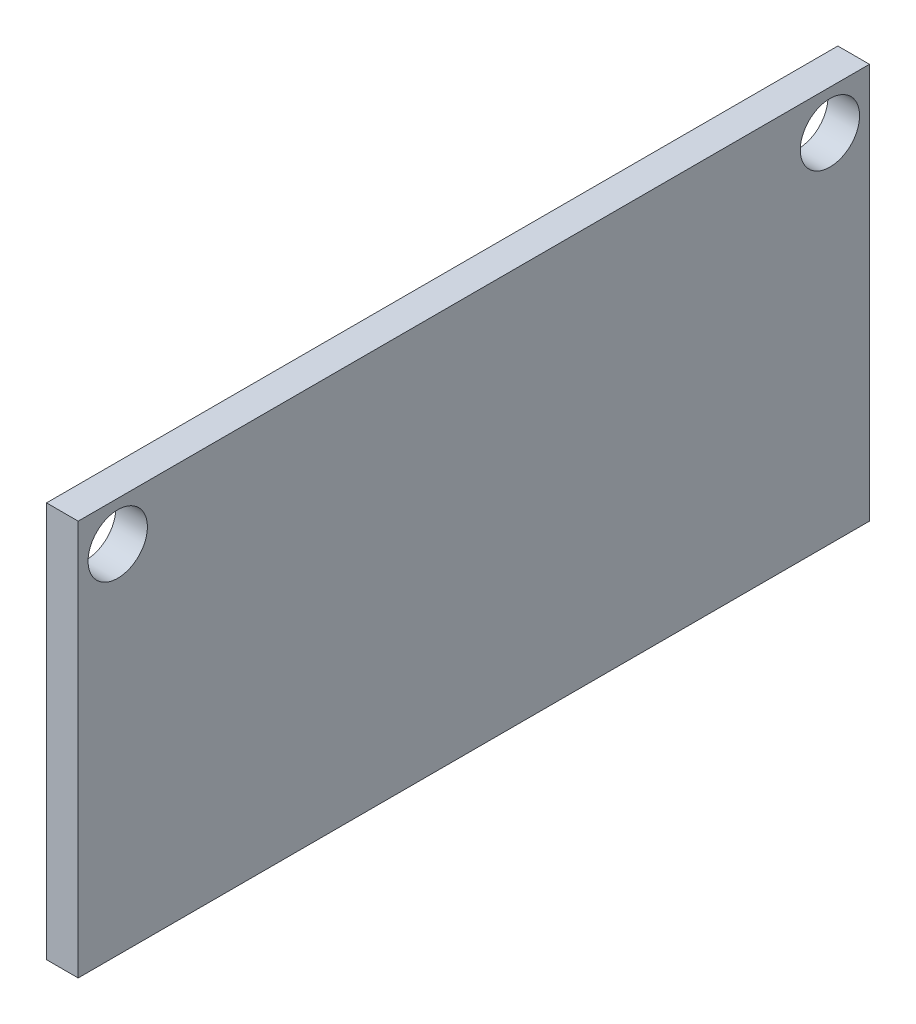
from build123d import *

# Parameters (mm, degrees)
ESQUISSE1_W      = 40
ESQUISSE1_H      = 20
ESQUISSE1_R      = 1.5
EXTRUSION1_DEPTH = 1.6


with BuildPart() as part:
    # Esquisse1 → Extrusion1 (new body)
    with BuildSketch(Plane(origin=(0, 0, 0), x_dir=(0, 0, -1), z_dir=(1, 0, 0))):
        with Locations((0, 10)):
            Rectangle(ESQUISSE1_W, ESQUISSE1_H)
        with Locations((-18, 18)):
            Circle(ESQUISSE1_R, mode=Mode.SUBTRACT)
        with Locations((18, 18)):
            Circle(ESQUISSE1_R, mode=Mode.SUBTRACT)
    extrude(amount=EXTRUSION1_DEPTH)


solid = part.part
